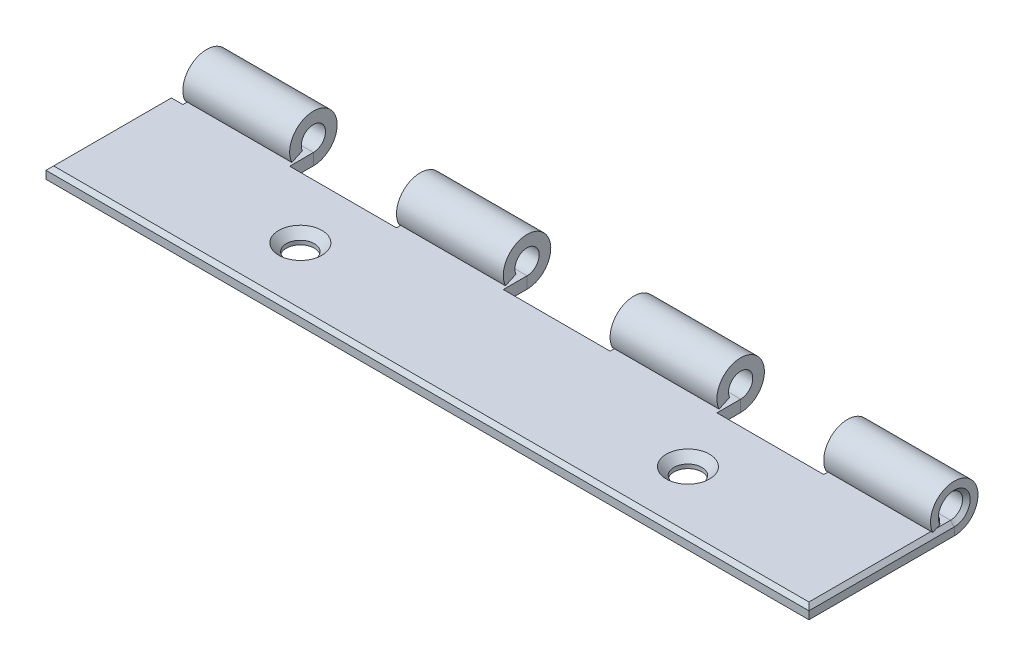
from build123d import *

# Parameters (mm, degrees)
SKETCH1_W          = 100
SKETCH1_H          = 22.1615
BASE_FLANGE1_DEPTH = 1.524
HEM1_START         = -50
HEM1_DEPTH         = 100
HEM1_2_DEPTH       = 100
CUT_EXTRUDE1_START = -52.42823759
SKETCH8_W          = 14
SKETCH8_H          = 6.223
CUT_EXTRUDE1_DEPTH = 94.856475179
LPATTERN1_COUNT    = 11
LPATTERN1_PITCH    = 28
CHAMFER1_SIZE      = 0.5
SKETCH9_R          = 1.8288
CUT_EXTRUDE2_DEPTH = 10
LPATTERN2_COUNT    = 6
LPATTERN2_PITCH    = 50.8
CHAMFER2_SIZE      = 1


# Read off the part's stored shape, not the designer's step: Hem1
# Sheet-metal steps are written as plain solids
with BuildPart() as part:
    # Sketch1 → Base-Flange1 (new body)
    with BuildSketch(Plane(origin=(0, 0, 0), x_dir=(1, 0, 0), z_dir=(0, 1, 0))):
        Rectangle(SKETCH1_W, SKETCH1_H)
    extrude(amount=-BASE_FLANGE1_DEPTH)

    # Hem1 outline → Hem1 (cut)
    with BuildSketch(Plane.YZ.offset(HEM1_START)):
        with BuildLine():
            Line((0, -11.08075), (0, -10.645306054))
            ThreePointArc((0, -10.645306054), (-1.116287945, -9.509043168), (-1.524, -7.96925))
            Line((-1.524, -7.96925), (-1.524, -11.08075))
            Line((-1.524, -11.08075), (0, -11.08075))
        make_face()
    extrude(amount=HEM1_DEPTH, mode=Mode.SUBTRACT)

    # Hem1 2 outline → Hem1 2 (add)
    with BuildSketch(Plane.YZ.offset(HEM1_START)):
        with BuildLine():
            Line((0.272523279, -5.149273321), (0.916593509, -6.530486388))
            ThreePointArc((0.916593509, -6.530486388), (2.92638392, -8.822213128), (0, -7.96925))
            Line((0, -7.96925), (0, -10.645306054))
            ThreePointArc((0, -10.645306054), (4.69518189, -8.123345818), (0.272523279, -5.149273321))
        make_face()
    extrude(amount=HEM1_2_DEPTH)

    # Sketch8 → Cut-Extrude1 (cut)
    with BuildSketch(Plane(origin=(0, 0, 0), x_dir=(1, 0, 0), z_dir=(0, 1, 0)).offset(CUT_EXTRUDE1_START)):
        with Locations((29, 7.96925)):
            Rectangle(SKETCH8_W, SKETCH8_H)
    cut_extrude1 = extrude(amount=CUT_EXTRUDE1_DEPTH, mode=Mode.SUBTRACT)

    # LPattern1: Cut-Extrude1 ×11
    with Locations(*[(-i * LPATTERN1_PITCH, 0, 0) for i in range(1, LPATTERN1_COUNT)]):
        add(cut_extrude1, mode=Mode.SUBTRACT)

    # Chamfer1
    chamfer1_edges = [part.edges().sort_by_distance(p)[0] for p in [
        (-50, 0, 3.1115),
        (50, 2.92638392, -8.822213128),
        (0, 0, 11.08075),
        (50, 0, 1.55575),
    ]]
    chamfer(chamfer1_edges, length=CHAMFER1_SIZE)

    # Sketch9 → Cut-Extrude2 (cut)
    with BuildSketch(Plane(origin=(0, 0, 0), x_dir=(1, 0, 0), z_dir=(0, 1, 0))):
        with Locations(Location((-24.6, -3.14325, 0), (0, 0, 270))):
            Circle(SKETCH9_R)
    cut_extrude2 = extrude(amount=-CUT_EXTRUDE2_DEPTH, mode=Mode.SUBTRACT)

    # LPattern2: Cut-Extrude2 ×6
    with Locations(*[(i * LPATTERN2_PITCH, 0, 0) for i in range(1, LPATTERN2_COUNT)]):
        add(cut_extrude2, mode=Mode.SUBTRACT)

    # Chamfer2
    chamfer2_edges = [part.edges().sort_by_distance(p)[0] for p in [
        (-24.6, 0, 1.31445),
        (26.2, 0, 1.31445),
    ]]
    chamfer(chamfer2_edges, length=CHAMFER2_SIZE)


solid = part.part
